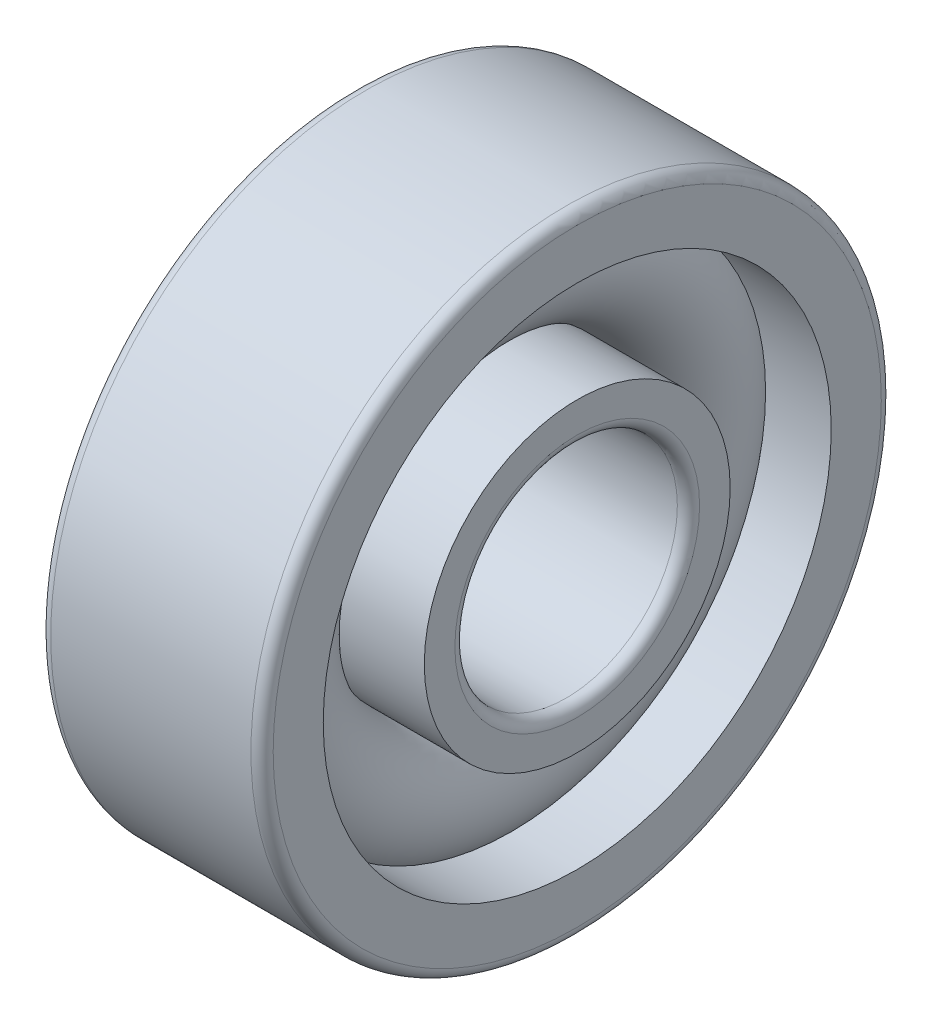
from build123d import *

# Parameters (mm, degrees)
CAGSPISKE_W     = 0.825
CAGSPISKE_H     = 0.55
CAGESPINE_ANGLE = 0.001
BALSIMSKE_R     = 1.65


with BuildPart() as part:
    # CagSpiSke → CageSpine (revolve)
    with BuildSketch(Plane.XY):
        with Locations((0, 5.75)):
            Rectangle(CAGSPISKE_W, CAGSPISKE_H)
    revolve(axis=Axis((-20.6375, 0, 0), (1, 0, 0)), revolution_arc=CAGESPINE_ANGLE)

    # BalSimSke → BallsSimplified (revolve)
    with BuildSketch(Plane.XY):
        with Locations((0, 5.75)):
            Circle(BALSIMSKE_R)
    revolve(axis=Axis((-10, 0, 0), (1, 0, 0)))

    # InnRacSke → InnerRace (revolve)
    with BuildSketch(Plane.XY):
        with BuildLine():
            Line((-1.196087371, 4.65), (-3, 4.65))
            Line((-3, 4.65), (-3, 3.3))
            ThreePointArc((-3, 3.3), (-2.912132034, 3.087867966), (-2.7, 3))
            Line((-2.7, 3), (2.7, 3))
            ThreePointArc((2.7, 3), (2.912132034, 3.087867966), (3, 3.3))
            Line((3, 3.3), (3, 4.125))
            Line((3, 4.125), (0, 4.125))
            ThreePointArc((0, 4.125), (-0.653117524, 4.262027386), (-1.196087371, 4.65))
        make_face()
    revolve(axis=Axis((-20.6375, 0, 0), (1, 0, 0)))

    # OutRacSke → OuterRace (revolve)
    with BuildSketch(Plane.XY):
        with BuildLine():
            Line((0, 7.375), (-3, 7.375))
            Line((-3, 7.375), (-3, 8.2))
            ThreePointArc((-3, 8.2), (-2.912132034, 8.412132034), (-2.7, 8.5))
            Line((-2.7, 8.5), (2.7, 8.5))
            ThreePointArc((2.7, 8.5), (2.912132034, 8.412132034), (3, 8.2))
            Line((3, 8.2), (3, 6.85))
            Line((3, 6.85), (1.196087371, 6.85))
            ThreePointArc((1.196087371, 6.85), (0.653117524, 7.237972614), (0, 7.375))
        make_face()
    revolve(axis=Axis((-20.6375, 0, 0), (1, 0, 0)))


solid = part.part
